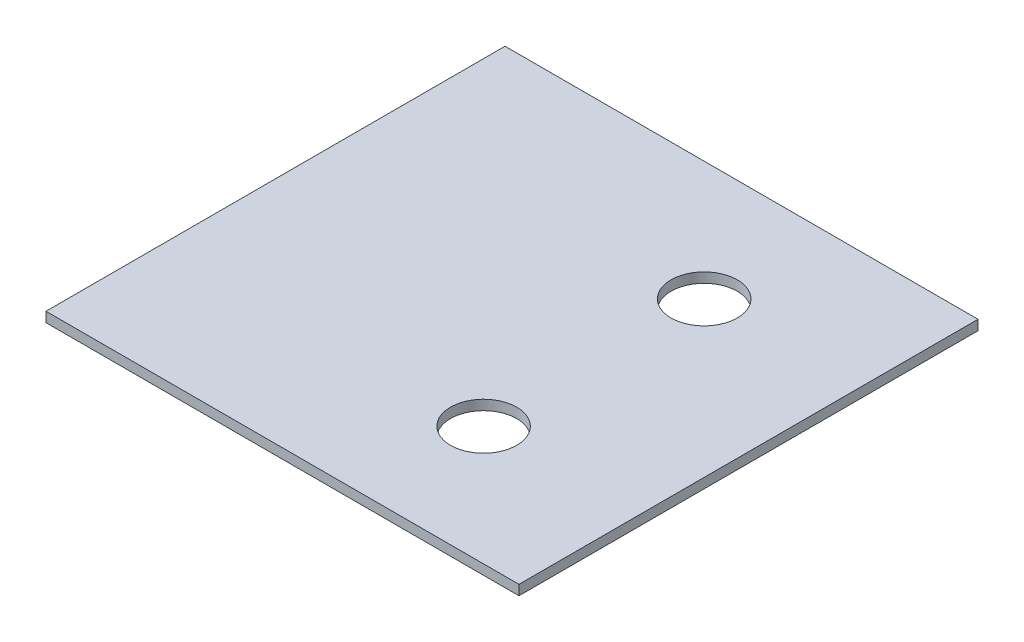
from build123d import *

# Parameters (mm, degrees)
SKETCH1_W           = 23.8
SKETCH1_H           = 23.1
BOSS_EXTRUDE1_DEPTH = 0.5
CUT_EXTRUDE1_REACH  = 18.591
SKETCH2_R           = 1.665


with BuildPart() as part:
    # Sketch1 → Boss-Extrude1 (new body)
    with BuildSketch(Plane(origin=(0, 0, 0), x_dir=(1, 0, 0), z_dir=(0, 1, 0))):
        Rectangle(SKETCH1_W, SKETCH1_H)
    extrude(amount=BOSS_EXTRUDE1_DEPTH)

    # Sketch2 → Cut-Extrude1 (cut, up to next)
    with BuildSketch(Plane(origin=(0, 0.5, 0), x_dir=(1, 0, 0), z_dir=(0, 1, 0)), mode=Mode.PRIVATE) as cut_extrude1_sk1:
        with Locations((4.121380866, 5.549386368)):
            Circle(SKETCH2_R)
    cut_extrude1_tool1 = extrude(cut_extrude1_sk1.sketch, amount=-CUT_EXTRUDE1_REACH, mode=Mode.PRIVATE) & part.part
    # Sketch2 → Cut-Extrude1 (cut, up to next)
    with BuildSketch(Plane(origin=(0, 0.5, 0), x_dir=(1, 0, 0), z_dir=(0, 1, 0)), mode=Mode.PRIVATE) as cut_extrude1_sk2:
        with Locations((4.121380866, -5.55)):
            Circle(SKETCH2_R)
    cut_extrude1_tool2 = extrude(cut_extrude1_sk2.sketch, amount=-CUT_EXTRUDE1_REACH, mode=Mode.PRIVATE) & part.part
    add(cut_extrude1_tool1.solids().sort_by_distance((4.121381, 0.5, -5.549386))[0], mode=Mode.SUBTRACT)
    add(cut_extrude1_tool2.solids().sort_by_distance((4.121381, 0.5, 5.55))[0], mode=Mode.SUBTRACT)


solid = part.part
